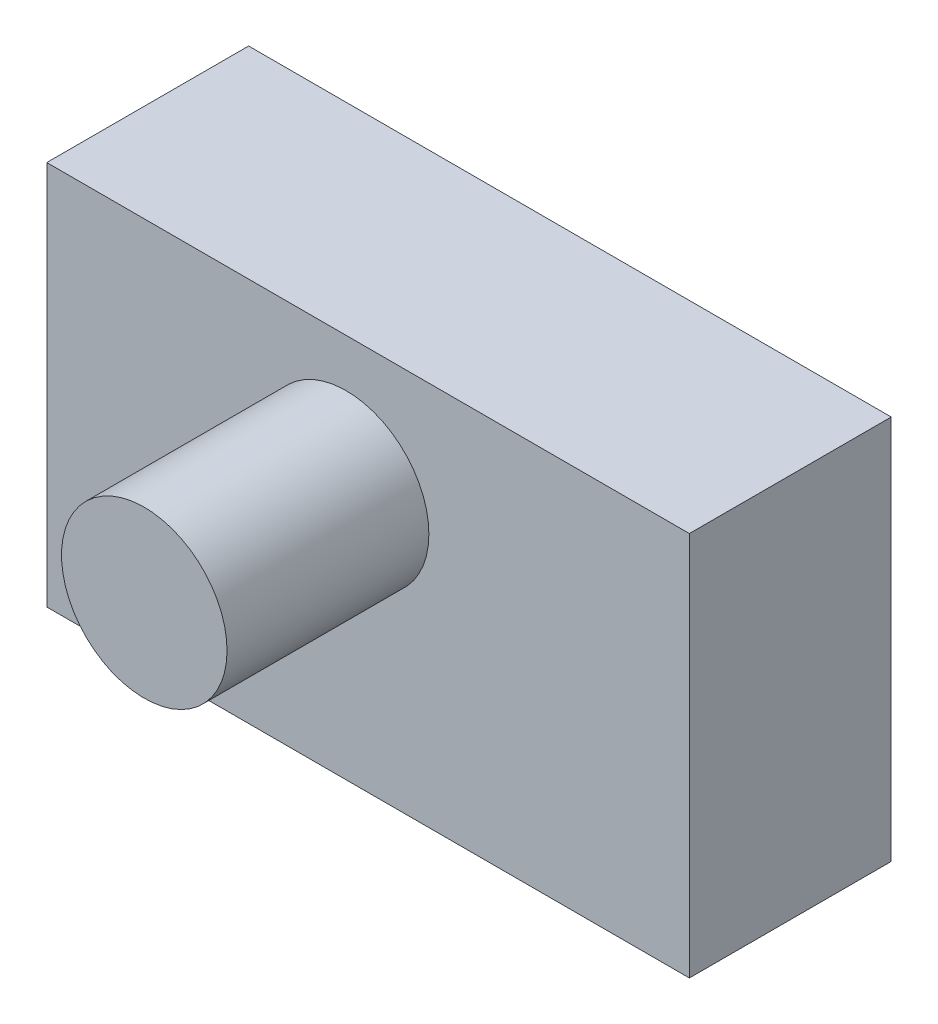
from build123d import *

# Parameters (mm, degrees)
SKETCH1_W           = 161.724310644
SKETCH1_H           = 96.872862076
BOSS_EXTRUDE1_DEPTH = 50.8
SKETCH2_R           = 20.831004362
BOSS_EXTRUDE2_DEPTH = 50.8


with BuildPart() as part:
    # Sketch1 → Boss-Extrude1 (new body)
    with BuildSketch(Plane.XY):
        Rectangle(SKETCH1_W, SKETCH1_H)
    extrude(amount=BOSS_EXTRUDE1_DEPTH)

    # Sketch2 → Boss-Extrude2 (add)
    with BuildSketch(Plane.XY.offset(50.8)):
        with Locations((-5.525694513, 15.560482637)):
            Circle(SKETCH2_R)
    extrude(amount=BOSS_EXTRUDE2_DEPTH)


solid = part.part
